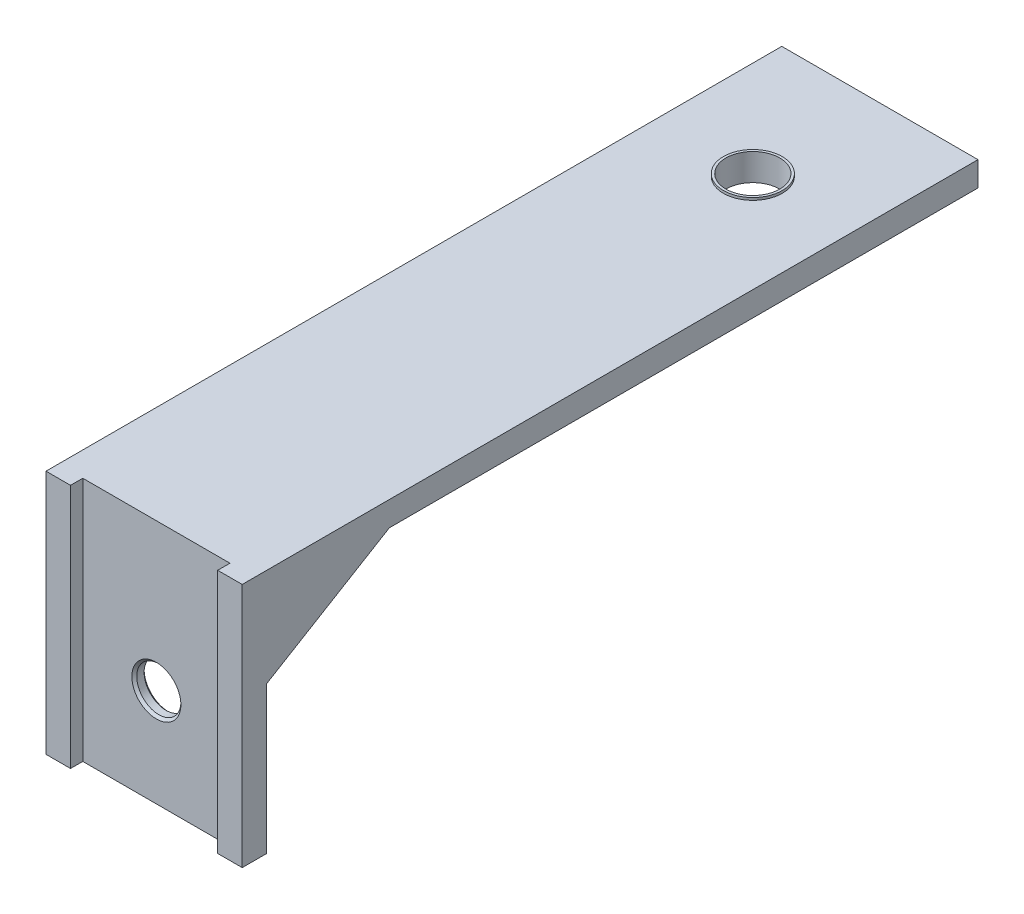
from build123d import *

# Parameters (mm, degrees)
DODANIE_WYCI_GNI_CIE1_DEPTH = 40
SZKIC2_W                    = 30
SZKIC2_H                    = 2.5
WYTNIJ_WYCI_GNI_CIE1_DEPTH  = 164.095064303
EBRO3_START                 = -5
EBRO3_DEPTH                 = 5
SZKIC4_R                    = 4.5
WYTNIJ_WYCI_GNI_CIE2_DEPTH  = 10
SFAZOWANIE1_SIZE            = 0.5
WYTNIJ_WYCI_GNI_CIE3_DEPTH  = 10
DODANIE_WYCI_GNI_CIE2_START = 0.5
SZKIC6_R                    = 6
SZKIC6_R_2                  = 5.5
DODANIE_WYCI_GNI_CIE2_DEPTH = 0.5


# Read off the part's stored shape, not the designer's step: Żebro3
with BuildPart() as part:
    # Szkic1 → Dodanie-wyciągnięcie1 (new body)
    with BuildSketch(Plane(origin=(0, 0, 0), x_dir=(0, 0, -1), z_dir=(1, 0, 0))):
        Polygon((0, 0), (0, 50), (150, 50), (150, 45), (5, 45), (5, 0), align=None)
    extrude(amount=DODANIE_WYCI_GNI_CIE1_DEPTH)

    # Szkic2 → Wytnij-wyciągnięcie1 (cut, through all)
    with BuildSketch(Plane(origin=(0, 50, 0), x_dir=(1, 0, 0), z_dir=(0, 1, 0))):
        with Locations((20, 1.25)):
            Rectangle(SZKIC2_W, SZKIC2_H)
    extrude(amount=-WYTNIJ_WYCI_GNI_CIE1_DEPTH, mode=Mode.SUBTRACT)

    # Żebro3 outline → Żebro3 (add)
    with BuildSketch(Plane(origin=(40, 0, 0), x_dir=(0, 0, -1), z_dir=(1, 0, 0)).offset(EBRO3_START)):
        Polygon((5, 30), (30, 45), (5, 45), align=None)
    ebro3 = extrude(amount=EBRO3_DEPTH)

    # Lustro1: Żebro3 across plane
    add(ebro3.mirror(Plane(origin=(20, 0, 0), x_dir=(0, 0, 1), z_dir=(1, 0, 0))))

    # Szkic4 → Wytnij-wyciągnięcie2 (cut)
    with BuildSketch(Plane(origin=(0, 0, -5), x_dir=(-1, 0, 0), z_dir=(0, 0, -1))):
        with Locations((-20, 20)):
            Circle(SZKIC4_R)
    extrude(amount=-WYTNIJ_WYCI_GNI_CIE2_DEPTH, mode=Mode.SUBTRACT)

    # Sfazowanie1
    sfazowanie1_edges = [part.edges().sort_by_distance(p)[0] for p in [
        (24.5, 20, -2.5),
        (24.5, 20, -5),
    ]]
    chamfer(sfazowanie1_edges, length=SFAZOWANIE1_SIZE)

    # Szkic5 → Wytnij-wyciągnięcie3 (cut)
    with BuildSketch(Plane(origin=(0, 50, 0), x_dir=(1, 0, 0), z_dir=(0, 1, 0))):
        with BuildLine():
            ThreePointArc((20, 129.597336258), (14.5, 124.097336258), (20, 118.597336258))
            Line((20, 118.597336258), (20, 129.597336258))
        make_face()
        with BuildLine():
            Line((20, 129.597336258), (20, 118.597336258))
            ThreePointArc((20, 118.597336258), (23.889087297, 120.208248962), (25.5, 124.097336258))
            ThreePointArc((25.5, 124.097336258), (23.889087297, 127.986423555), (20, 129.597336258))
        make_face()
    extrude(amount=-WYTNIJ_WYCI_GNI_CIE3_DEPTH, mode=Mode.SUBTRACT)

    # Szkic6 → Dodanie-wyciągnięcie2 (add)
    with BuildSketch(Plane(origin=(0, 50, 0), x_dir=(1, 0, 0), z_dir=(0, 1, 0)).offset(DODANIE_WYCI_GNI_CIE2_START)):
        with Locations(Location((20, 124.097336258, 0), (0, 0, 270))):
            Circle(SZKIC6_R)
        with Locations(Location((20, 124.097336258, 0), (0, 0, 270))):
            Circle(SZKIC6_R_2, mode=Mode.SUBTRACT)
    extrude(amount=-DODANIE_WYCI_GNI_CIE2_DEPTH)


solid = part.part
